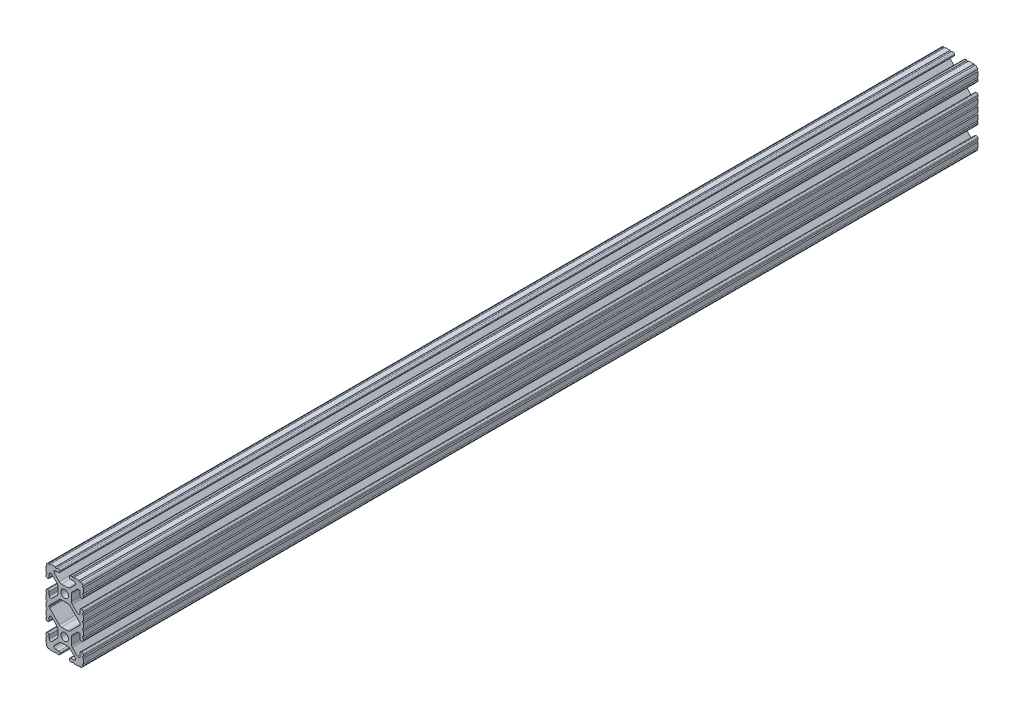
from build123d import *

# Parameters (mm, degrees)
BOSS_EXTRUDE1_DEPTH     = 304.8
CUT_EXTRUDE1_DEPTH      = 307.120058147
CUT_EXTRUDE1_DEPTH_BACK = 307.120058147
SKETCH5_R               = 0.55245
BOSS_EXTRUDE2_DEPTH     = 304.8
CUT_EXTRUDE2_DEPTH      = 307.120058147
CUT_EXTRUDE2_DEPTH_BACK = 307.120058147


with BuildPart() as part:
    # Sketch4 → Boss-Extrude1 (new, symmetric)
    with BuildSketch(Plane.XY):
        with BuildLine():
            Line((4.190365, -25.4), (10.11729625, -25.4))
            ThreePointArc((10.11729625, -25.4), (11.943543585, -24.643543585), (12.7, -22.81729625))
            Line((12.7, -22.81729625), (12.7, -16.890365))
            ThreePointArc((12.7, -16.890365), (12.42492494, -16.22627506), (11.760835, -15.9512))
            Line((11.760835, -15.9512), (11.429365, -15.9512))
            ThreePointArc((11.429365, -15.9512), (10.76527506, -16.22627506), (10.4902, -16.890365))
            Line((10.4902, -16.890365), (10.4902, -19.048478019))
            ThreePointArc((10.4902, -19.048478019), (9.830707141, -20.035478831), (8.666460301, -19.803895736))
            Line((8.666460301, -19.803895736), (5.299899128, -16.437334563))
            ThreePointArc((5.299899128, -16.437334563), (4.817571085, -15.715479634), (4.6482, -14.86399369))
            Line((4.6482, -14.86399369), (4.6482, -12.7))
            Line((4.6482, -12.7), (2.6035, -12.7))
            ThreePointArc((2.6035, -12.7), (1.840952505, -14.540952505), (0, -15.3035))
            Line((0, -15.3035), (0, -17.3482))
            Line((0, -17.3482), (2.16399369, -17.3482))
            ThreePointArc((2.16399369, -17.3482), (3.015479634, -17.517571085), (3.737334563, -17.999899128))
            Line((3.737334563, -17.999899128), (7.103895736, -21.366460301))
            ThreePointArc((7.103895736, -21.366460301), (7.335478831, -22.530707141), (6.348478019, -23.1902))
            Line((6.348478019, -23.1902), (4.190365, -23.1902))
            ThreePointArc((4.190365, -23.1902), (3.52627506, -23.46527506), (3.2512, -24.129365))
            Line((3.2512, -24.129365), (3.2512, -24.460835))
            ThreePointArc((3.2512, -24.460835), (3.52627506, -25.12492494), (4.190365, -25.4))
        make_face()
    extrude(amount=BOSS_EXTRUDE1_DEPTH, both=True)

    # Sketch5 → Cut-Extrude1 (cut, two sides: drawn at the far end of the back side and taken through both)
    with BuildSketch(Plane.XY.offset(-CUT_EXTRUDE1_DEPTH_BACK)):
        with Locations((10.356153152, -25.4)):
            Circle(SKETCH5_R)
        with Locations((5.796028019, -25.4)):
            Circle(SKETCH5_R)
        with Locations((12.7, -23.056153152)):
            Circle(SKETCH5_R)
        with Locations((12.7, -18.496028019)):
            Circle(SKETCH5_R)
    extrude(amount=CUT_EXTRUDE1_DEPTH + CUT_EXTRUDE1_DEPTH_BACK, mode=Mode.SUBTRACT)

    # Mirror1: part across plane


with BuildPart() as part_1:
    add(part.part)
    add(part.part.mirror(Plane(origin=(4.6482, -12.7, 304.8), x_dir=(0, 0, 1), z_dir=(0, -1, 0))))

    # Sketch6 → Boss-Extrude2 (add, symmetric)
    with BuildSketch(Plane.XY):
        with BuildLine():
            Line((12.7, -1.791396848), (12.7, 0))
            Line((12.7, 0), (9.803703152, 0))
            Line((9.803703152, 0), (9.803703152, -2.343846848))
            Line((9.803703152, -2.343846848), (12.14755, -2.343846848))
            ThreePointArc((12.14755, -2.343846848), (12.309358859, -1.953205706), (12.7, -1.791396848))
        make_face()
    extrude(amount=BOSS_EXTRUDE2_DEPTH, both=True)

    # Sketch7 → Cut-Extrude2 (cut, two sides: drawn at the far end of the back side and taken through both)
    with BuildSketch(Plane.XY.offset(-CUT_EXTRUDE2_DEPTH_BACK)):
        with BuildLine():
            Line((5.420615149, -5.716820286), (10.328391141, -0.809044294))
            ThreePointArc((10.328391141, -0.809044294), (10.448147248, -0.629816615), (10.4902, -0.418403152))
            Line((10.4902, -0.418403152), (10.4902, 0))
            Line((10.4902, 0), (0, 0))
            Line((0, 0), (5.420615149, -5.716820286))
        make_face()
    extrude(amount=CUT_EXTRUDE2_DEPTH + CUT_EXTRUDE2_DEPTH_BACK, mode=Mode.SUBTRACT)

    # Mirror2: part across plane


with BuildPart() as part_2:
    add(part_1.part)
    add(part_1.part.mirror(Plane.ZX))

    # Mirror3: part across plane


with BuildPart() as part_3:
    add(part_2.part)
    add(part_2.part.mirror(Plane(origin=(0, 0, 0), x_dir=(0, 0, 1), z_dir=(1, 0, 0))))


solid = part_3.part
